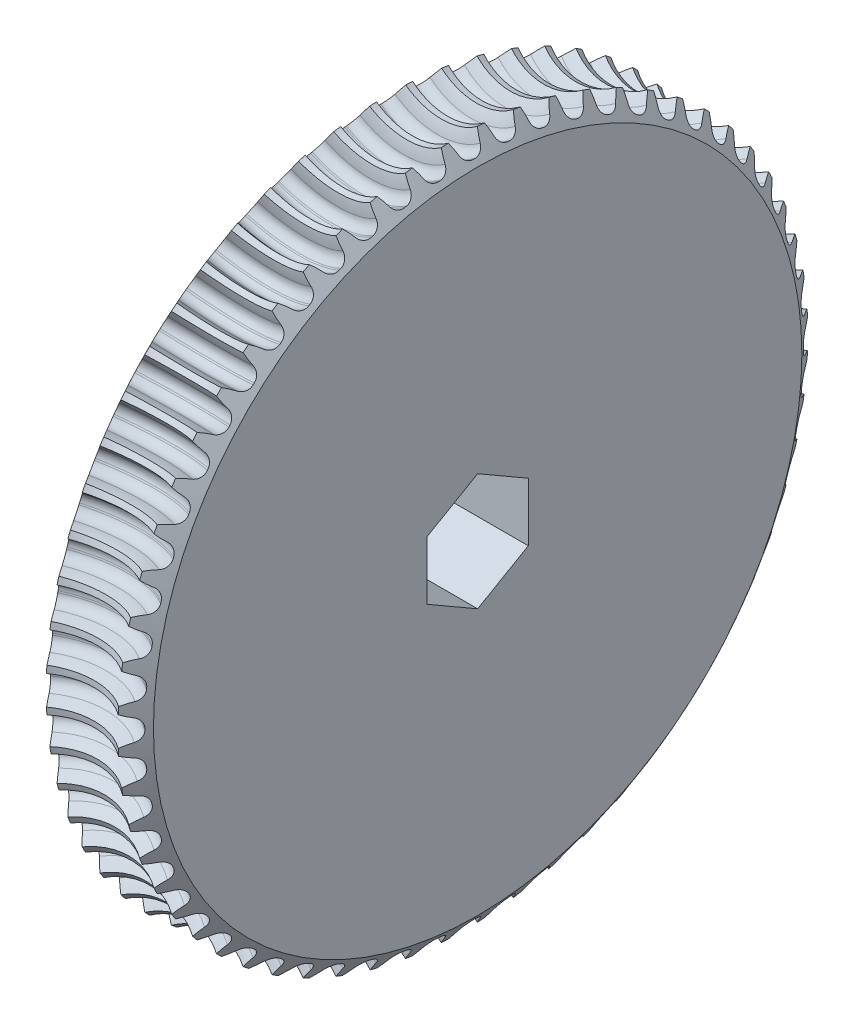
from build123d import *

# Parameters (mm, degrees)
RACCORDO2_R                          = 0.5
RIPETIZIONECIRCOLARE1_COUNT          = 60
RACCORDO2_OF_RIPETIZIONECIRCOLARE1_R = 0.5
TAGLIO_ESTRUSIONE1_DEPTH             = 25.182952054
TAGLIO_ESTRUSIONE1_DEPTH_BACK        = 25.182952054


with BuildPart() as part:
    # Schizzo1 → Rivoluzione1 (revolve)
    with BuildSketch(Plane.XY):
        with BuildLine():
            Line((-2.5, 0), (2.5, 0))
            Line((2.5, 0), (2.5, 16))
            Line((2.5, 16), (1.769987478, 17.022017531))
            ThreePointArc((1.769987478, 17.022017531), (0.000278112, 16.445327267), (-1.768963423, 17.023451208))
            Line((-1.768963423, 17.023451208), (-2.5, 16))
            Line((-2.5, 16), (-2.5, 0))
        make_face()
    revolve(axis=Axis((-2.5, 0, 0), (1, 0, 0)))

    # Schizzo2 → Taglia-Rivoluzione1 (revolve, cut)
    with BuildSketch(Plane(origin=(0, 0, 0), x_dir=(0, 0, -1), z_dir=(1, 0, 0))):
        with BuildLine():
            Line((1.530737533, 17.648913895), (-1.530737533, 17.648913895))
            ThreePointArc((-1.530737533, 17.648913895), (-0.820914571, 16.655620212), (-0.446604889, 15.493564602))
            Line((-0.446604889, 15.493564602), (0.446604889, 15.493564602))
            ThreePointArc((0.446604889, 15.493564602), (0.820914571, 16.655620212), (1.530737533, 17.648913895))
        make_face()
    taglia_rivoluzione1 = revolve(axis=Axis((0, 19.445327021, 0), (0, 0, -1)), mode=Mode.SUBTRACT)

    # Raccordo2
    raccordo2_edges = [part.edges().sort_by_distance(p)[0] for p in [
        (0, 15.493564602, -0.446604889),
        (0, 15.493564602, 0.446604889),
    ]]
    fillet(raccordo2_edges, radius=RACCORDO2_R)

    # RipetizioneCircolare1: Taglia-Rivoluzione1 ×60 about axis
    ripetizionecircolare1_axis = Axis((1.769987478, 0, 0), (-1, 0, 0))
    for i in range(1, RIPETIZIONECIRCOLARE1_COUNT):
        add(taglia_rivoluzione1.rotate(ripetizionecircolare1_axis, i * 360 / RIPETIZIONECIRCOLARE1_COUNT), mode=Mode.SUBTRACT)

    # Raccordo2 of RipetizioneCircolare1
    raccordo2_of_ripetizionecircolare1_edges = [part.edges().sort_by_distance(p)[0] for p in [
        (0, 15.362006311, -2.063676839),
        (0, 15.455372157, -1.175360158),
        (0, 15.062138665, -3.658138714),
        (0, 15.24784742, -2.784447713),
        (0, 14.597247075, -5.212521255),
        (0, 14.873264076, -4.363028276),
        (0, 13.972424992, -6.709794323),
        (0, 14.335726138, -5.893806588),
        (0, 13.194518096, -8.13355348),
        (0, 13.641122985, -7.360011122),
        (0, 12.272049299, -9.468199723),
        (0, 12.797064834, -8.745577834),
        (0, 11.215125362, -10.699110389),
        (0, 11.812799362, -10.035326165),
        (0, 10.035326165, -11.812799362),
        (0, 10.699110389, -11.215125362),
        (0, 8.745577834, -12.797064834),
        (0, 9.468199723, -12.272049299),
        (0, 7.360011122, -13.641122985),
        (0, 8.13355348, -13.194518096),
        (0, 5.893806588, -14.335726138),
        (0, 6.709794323, -13.972424992),
        (0, 4.363028276, -14.873264076),
        (0, 5.212521255, -14.597247075),
        (0, 2.784447713, -15.24784742),
        (0, 3.658138714, -15.062138665),
        (0, 1.175360158, -15.455372157),
        (0, 2.063676839, -15.362006311),
        (0, -0.446604889, -15.493564602),
        (0, 0.446604889, -15.493564602),
        (0, -2.063676839, -15.362006311),
        (0, -1.175360158, -15.455372157),
        (0, -3.658138714, -15.062138665),
        (0, -2.784447713, -15.24784742),
        (0, -5.212521255, -14.597247075),
        (0, -4.363028276, -14.873264076),
        (0, -6.709794323, -13.972424992),
        (0, -5.893806588, -14.335726138),
        (0, -8.13355348, -13.194518096),
        (0, -7.360011122, -13.641122985),
        (0, -9.468199723, -12.272049299),
        (0, -8.745577834, -12.797064834),
        (0, -10.699110389, -11.215125362),
        (0, -10.035326165, -11.812799362),
        (0, -11.812799362, -10.035326165),
        (0, -11.215125362, -10.699110389),
        (0, -12.797064834, -8.745577834),
        (0, -12.272049299, -9.468199723),
        (0, -13.641122985, -7.360011122),
        (0, -13.194518096, -8.13355348),
        (0, -14.335726138, -5.893806588),
        (0, -13.972424992, -6.709794323),
        (0, -14.873264076, -4.363028276),
        (0, -14.597247075, -5.212521255),
        (0, -15.24784742, -2.784447713),
        (0, -15.062138665, -3.658138714),
        (0, -15.455372157, -1.175360158),
        (0, -15.362006311, -2.063676839),
        (0, -15.493564602, 0.446604889),
        (0, -15.493564602, -0.446604889),
        (0, -15.362006311, 2.063676839),
        (0, -15.455372157, 1.175360158),
        (0, -15.062138665, 3.658138714),
        (0, -15.24784742, 2.784447713),
        (0, -14.597247075, 5.212521255),
        (0, -14.873264076, 4.363028276),
        (0, -13.972424992, 6.709794323),
        (0, -14.335726138, 5.893806588),
        (0, -13.194518096, 8.13355348),
        (0, -13.641122985, 7.360011122),
        (0, -12.272049299, 9.468199723),
        (0, -12.797064834, 8.745577834),
        (0, -11.215125362, 10.699110389),
        (0, -11.812799362, 10.035326165),
        (0, -10.035326165, 11.812799362),
        (0, -10.699110389, 11.215125362),
        (0, -8.745577834, 12.797064834),
        (0, -9.468199723, 12.272049299),
        (0, -7.360011122, 13.641122985),
        (0, -8.13355348, 13.194518096),
        (0, -5.893806588, 14.335726138),
        (0, -6.709794323, 13.972424992),
        (0, -4.363028276, 14.873264076),
        (0, -5.212521255, 14.597247075),
        (0, -2.784447713, 15.24784742),
        (0, -3.658138714, 15.062138665),
        (0, -1.175360158, 15.455372157),
        (0, -2.063676839, 15.362006311),
        (0, 0.446604889, 15.493564602),
        (0, -0.446604889, 15.493564602),
        (0, 2.063676839, 15.362006311),
        (0, 1.175360158, 15.455372157),
        (0, 3.658138714, 15.062138665),
        (0, 2.784447713, 15.24784742),
        (0, 5.212521255, 14.597247075),
        (0, 4.363028276, 14.873264076),
        (0, 6.709794323, 13.972424992),
        (0, 5.893806588, 14.335726138),
        (0, 8.13355348, 13.194518096),
        (0, 7.360011122, 13.641122985),
        (0, 9.468199723, 12.272049299),
        (0, 8.745577834, 12.797064834),
        (0, 10.699110389, 11.215125362),
        (0, 10.035326165, 11.812799362),
        (0, 11.812799362, 10.035326165),
        (0, 11.215125362, 10.699110389),
        (0, 12.797064834, 8.745577834),
        (0, 12.272049299, 9.468199723),
        (0, 13.641122985, 7.360011122),
        (0, 13.194518096, 8.13355348),
        (0, 14.335726138, 5.893806588),
        (0, 13.972424992, 6.709794323),
        (0, 14.873264076, 4.363028276),
        (0, 14.597247075, 5.212521255),
        (0, 15.24784742, 2.784447713),
        (0, 15.062138665, 3.658138714),
        (0, 15.455372157, 1.175360158),
        (0, 15.362006311, 2.063676839),
    ]]
    fillet(raccordo2_of_ripetizionecircolare1_edges, radius=RACCORDO2_OF_RIPETIZIONECIRCOLARE1_R)

    # Schizzo3 → Taglio-Estrusione1 (cut, two sides: drawn at the far end of the back side and taken through both)
    with BuildSketch(Plane(origin=(0, 0, 0), x_dir=(0, 0, -1), z_dir=(1, 0, 0)).offset(-TAGLIO_ESTRUSIONE1_DEPTH_BACK)):
        Polygon((0, 2.886751346), (-2.5, 1.443375673), (-2.5, -1.443375673), (0, -2.886751346), (2.5, -1.443375673), (2.5, 1.443375673), align=None)
    extrude(amount=TAGLIO_ESTRUSIONE1_DEPTH + TAGLIO_ESTRUSIONE1_DEPTH_BACK, mode=Mode.SUBTRACT)


solid = part.part
